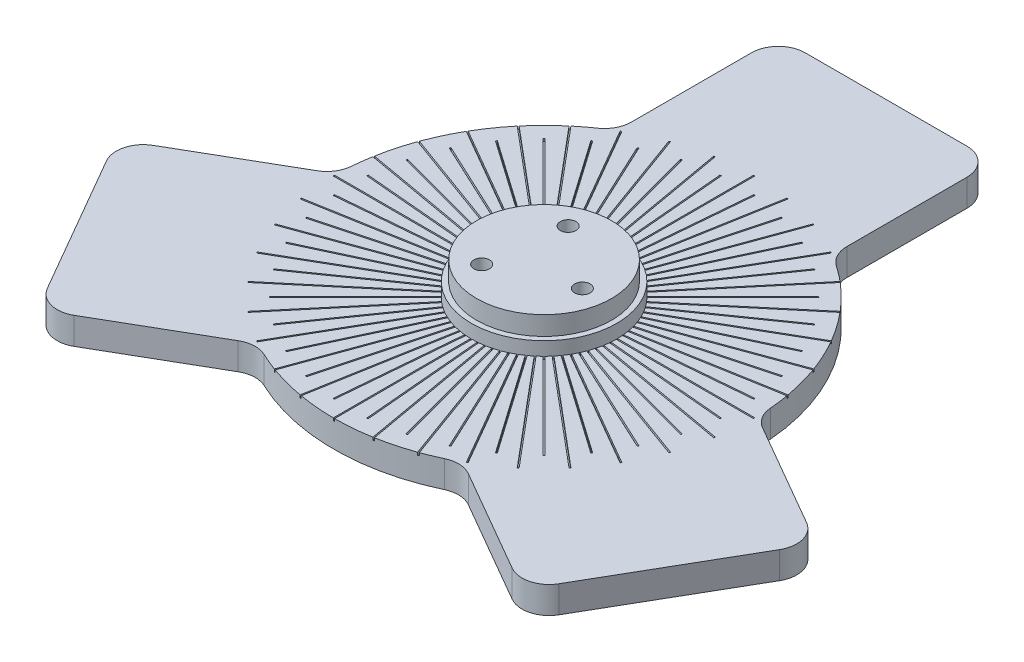
from build123d import *

# Parameters (mm, degrees)
BOSS_EXTRUDE1_DEPTH           = 10
SKETCH2_R                     = 27
BOSS_EXTRUDE2_DEPTH           = 5
SKETCH3_R                     = 25.05
BOSS_EXTRUDE3_DEPTH           = 7
CBORE_FOR_M5_SHCS1_AT_2_COUNT = 2
CBORE_FOR_M5_SHCS1_AT_2_PITCH = 28.596158833
CBORE_FOR_M5_SHCS1_AT_3_COUNT = 2
CBORE_FOR_M5_SHCS1_AT_3_PITCH = 28.596158833
FILLET1_R                     = 10
SKETCH7_W                     = 0.5
SKETCH7_H                     = 51
SKETCH7_W_2                   = 51
SKETCH7_H_2                   = 0.5
CUT_EXTRUDE2_DEPTH            = 1
CUT_EXTRUDE3_DEPTH            = 1


with BuildPart() as part:
    # Sketch1 → Boss-Extrude1 (new body)
    with BuildSketch(Plane(origin=(0, 0, 0), x_dir=(1, 0, 0), z_dir=(0, 1, 0))):
        with BuildLine():
            Line((-40, 126.962676171), (-40, 66.962676171))
            ThreePointArc((-40, 66.962676171), (-67.549981495, 39), (-77.99137867, 1.159678066))
            Line((-77.99137867, 1.159678066), (-129.952902897, -28.840321934))
            Line((-129.952902897, -28.840321934), (-89.952902897, -98.122354237))
            Line((-89.952902897, -98.122354237), (-37.99137867, -68.122354237))
            ThreePointArc((-37.99137867, -68.122354237), (0, -78), (37.99137867, -68.122354237))
            Line((37.99137867, -68.122354237), (89.952902897, -98.122354237))
            Line((89.952902897, -98.122354237), (129.952902897, -28.840321934))
            Line((129.952902897, -28.840321934), (77.99137867, 1.159678066))
            ThreePointArc((77.99137867, 1.159678066), (67.549981495, 39), (40, 66.962676171))
            Line((40, 66.962676171), (40, 126.962676171))
            Line((40, 126.962676171), (-40, 126.962676171))
        make_face()
    extrude(amount=BOSS_EXTRUDE1_DEPTH)

    # Sketch2 → Boss-Extrude2 (add)
    with BuildSketch(Plane(origin=(0, 10, 0), x_dir=(1, 0, 0), z_dir=(0, 1, 0))):
        Circle(SKETCH2_R)
    extrude(amount=BOSS_EXTRUDE2_DEPTH)

    # Sketch3 → Boss-Extrude3 (add)
    with BuildSketch(Plane(origin=(0, 15, 0), x_dir=(1, 0, 0), z_dir=(0, 1, 0))):
        Circle(SKETCH3_R)
    extrude(amount=BOSS_EXTRUDE3_DEPTH)

    # Sketch5 → CBORE for M5 SHCS1 (revolve, cut)
    with BuildSketch(Plane(origin=(16.368754661, 0, 2.154987434), x_dir=(0, 0, -1), z_dir=(1, 0, 0))):
        Polygon((0, 0), (0, 22), (2.9, 22), (2.9, 5), (5, 5), (5, 0.025), (5.025, 0), align=None)
    cbore_for_m5_shcs1 = revolve(axis=Axis((16.368754661, -6.35, 2.154987434), (0, 1, 0)), mode=Mode.SUBTRACT)

    # CBORE for M5 SHCS1 at 2: CBORE for M5 SHCS1 ×2
    with Locations(*[Vector(-0.7933533402912365, 0, -0.608761429008719) * (i * CBORE_FOR_M5_SHCS1_AT_2_PITCH) for i in range(1, CBORE_FOR_M5_SHCS1_AT_2_COUNT)]):
        add(cbore_for_m5_shcs1, mode=Mode.SUBTRACT)

    # CBORE for M5 SHCS1 at 3: CBORE for M5 SHCS1 ×2
    with Locations(*[Vector(-0.9238795325112866, 0, 0.38268343236509017) * (i * CBORE_FOR_M5_SHCS1_AT_3_PITCH) for i in range(1, CBORE_FOR_M5_SHCS1_AT_3_COUNT)]):
        add(cbore_for_m5_shcs1, mode=Mode.SUBTRACT)

    # Fillet1
    fillet1_edges = [part.edges().sort_by_distance(p)[0] for p in [
        (40, 5, -66.962676171),
        (-40, 5, -66.962676171),
        (40, 5, -126.962676171),
        (-40, 5, -126.962676171),
        (77.99137867, 5, -1.159678066),
        (129.952902897, 5, 28.840321934),
        (89.952902897, 5, 98.122354237),
        (37.99137867, 5, 68.122354237),
        (-37.99137867, 5, 68.122354237),
        (-89.952902897, 5, 98.122354237),
        (-129.952902897, 5, 28.840321934),
        (-77.99137867, 5, -1.159678066),
    ]]
    fillet(fillet1_edges, radius=FILLET1_R)

    # Sketch7 → Cut-Extrude2 (cut)
    with BuildSketch(Plane(origin=(0, 10, 0), x_dir=(1, 0, 0), z_dir=(0, 1, 0))):
        Polygon((13.29835592, 76.858416779), (4.442298859, 26.633221376), (4.934702735, 26.546397287), (13.790759796, 76.771592691), align=None)
        with Locations((0, 52.5)):
            Rectangle(SKETCH7_W, SKETCH7_H)
        Polygon((26.442648024, 73.381529457), (8.999620715, 25.457205797), (9.469467025, 25.286195725), (26.912494335, 73.210519385), align=None)
        Polygon((38.783493649, 67.674981495), (13.283493649, 23.507685902), (13.716506351, 23.257685902), (39.216506351, 67.424981495), align=None)
        Polygon((49.945922445, 59.912163466), (17.163754351, 20.843896867), (17.546776572, 20.522503062), (50.328944666, 59.590769661), align=None)
        Polygon((59.590769661, 50.328944666), (20.522503062, 17.546776572), (20.843896867, 17.163754351), (59.912163466, 49.945922445), align=None)
        Polygon((67.424981495, 39.216506351), (23.257685902, 13.716506351), (23.507685902, 13.283493649), (67.674981495, 38.783493649), align=None)
        Polygon((73.210519385, 26.912494335), (25.286195725, 9.469467025), (25.457205797, 8.999620715), (73.381529457, 26.442648024), align=None)
        Polygon((76.771592691, 13.790759796), (26.546397287, 4.934702735), (26.633221376, 4.442298859), (76.858416779, 13.29835592), align=None)
        with Locations((52.5, 0)):
            Rectangle(SKETCH7_W_2, SKETCH7_H_2)
        Polygon((76.858416779, -13.29835592), (26.633221376, -4.442298859), (26.546397287, -4.934702735), (76.771592691, -13.790759796), align=None)
        Polygon((73.381529457, -26.442648024), (25.457205797, -8.999620715), (25.286195725, -9.469467025), (73.210519385, -26.912494335), align=None)
        Polygon((67.674981495, -38.783493649), (23.507685902, -13.283493649), (23.257685902, -13.716506351), (67.424981495, -39.216506351), align=None)
        Polygon((59.912163466, -49.945922445), (20.843896867, -17.163754351), (20.522503062, -17.546776572), (59.590769661, -50.328944666), align=None)
        Polygon((50.328944666, -59.590769661), (17.546776572, -20.522503062), (17.163754351, -20.843896867), (49.945922445, -59.912163466), align=None)
        Polygon((39.216506351, -67.424981495), (13.716506351, -23.257685902), (13.283493649, -23.507685902), (38.783493649, -67.674981495), align=None)
        Polygon((26.912494335, -73.210519385), (9.469467025, -25.286195725), (8.999620715, -25.457205797), (26.442648024, -73.381529457), align=None)
        Polygon((13.790759796, -76.771592691), (4.934702735, -26.546397287), (4.442298859, -26.633221376), (13.29835592, -76.858416779), align=None)
        with Locations((0, -52.5)):
            Rectangle(SKETCH7_W, SKETCH7_H)
        Polygon((-13.29835592, -76.858416779), (-4.442298859, -26.633221376), (-4.934702735, -26.546397287), (-13.790759796, -76.771592691), align=None)
        Polygon((-26.442648024, -73.381529457), (-8.999620715, -25.457205797), (-9.469467025, -25.286195725), (-26.912494335, -73.210519385), align=None)
        Polygon((-38.783493649, -67.674981495), (-13.283493649, -23.507685902), (-13.716506351, -23.257685902), (-39.216506351, -67.424981495), align=None)
        Polygon((-49.945922445, -59.912163466), (-17.163754351, -20.843896867), (-17.546776572, -20.522503062), (-50.328944666, -59.590769661), align=None)
        Polygon((-59.590769661, -50.328944666), (-20.522503062, -17.546776572), (-20.843896867, -17.163754351), (-59.912163466, -49.945922445), align=None)
        Polygon((-67.424981495, -39.216506351), (-23.257685902, -13.716506351), (-23.507685902, -13.283493649), (-67.674981495, -38.783493649), align=None)
        Polygon((-73.210519385, -26.912494335), (-25.286195725, -9.469467025), (-25.457205797, -8.999620715), (-73.381529457, -26.442648024), align=None)
        Polygon((-76.771592691, -13.790759796), (-26.546397287, -4.934702735), (-26.633221376, -4.442298859), (-76.858416779, -13.29835592), align=None)
        with Locations((-52.5, 0)):
            Rectangle(SKETCH7_W_2, SKETCH7_H_2)
        Polygon((-76.858416779, 13.29835592), (-26.633221376, 4.442298859), (-26.546397287, 4.934702735), (-76.771592691, 13.790759796), align=None)
        Polygon((-73.381529457, 26.442648024), (-25.457205797, 8.999620715), (-25.286195725, 9.469467025), (-73.210519385, 26.912494335), align=None)
        Polygon((-67.674981495, 38.783493649), (-23.507685902, 13.283493649), (-23.257685902, 13.716506351), (-67.424981495, 39.216506351), align=None)
        Polygon((-59.912163466, 49.945922445), (-20.843896867, 17.163754351), (-20.522503062, 17.546776572), (-59.590769661, 50.328944666), align=None)
        Polygon((-50.328944666, 59.590769661), (-17.546776572, 20.522503062), (-17.163754351, 20.843896867), (-49.945922445, 59.912163466), align=None)
        Polygon((-39.216506351, 67.424981495), (-13.716506351, 23.257685902), (-13.283493649, 23.507685902), (-38.783493649, 67.674981495), align=None)
        Polygon((-26.912494335, 73.210519385), (-9.469467025, 25.286195725), (-8.999620715, 25.457205797), (-26.442648024, 73.381529457), align=None)
        Polygon((-13.790759796, 76.771592691), (-4.934702735, 26.546397287), (-4.442298859, 26.633221376), (-13.29835592, 76.858416779), align=None)
    extrude(amount=-CUT_EXTRUDE2_DEPTH, mode=Mode.SUBTRACT)

    # Sketch8 → Cut-Extrude3 (cut)
    with BuildSketch(Plane(origin=(0, 10, 0), x_dir=(1, 0, 0), z_dir=(0, 1, 0))):
        Polygon((2.111238956, 27), (6.033247379, 71.828761414), (6.535157298, 71.828761414), (2.613148875, 27), align=None)
        Polygon((7.261950068, 26.136040791), (6.767665289, 26.223196534), (18.414522319, 69.689858717), (18.908807098, 69.602702974), align=None)
        Polygon((11.690100584, 24.477951209), (11.218459537, 24.649614511), (30.236281316, 65.433464928), (30.707922363, 65.261801625), align=None)
        Polygon((15.763053309, 22.076111465), (15.328386569, 22.327066424), (41.139326205, 59.188908417), (41.573992945, 58.937953458), align=None)
        Polygon((19.357053636, 19.003500245), (18.972568332, 19.326121722), (50.792373485, 51.145926876), (51.176858789, 50.823305399), align=None)
        Polygon((22.362899683, 15.353477287), (22.040278206, 15.737962591), (58.902120199, 41.548902227), (59.224741676, 41.164416923), align=None)
        Polygon((24.689260339, 11.236946691), (24.43830538, 11.671613431), (65.222155797, 30.689435209), (65.473110756, 30.254768469), align=None)
        Polygon((26.265450314, 6.778987155), (26.093787011, 7.250628202), (69.560449194, 18.897485232), (69.732112497, 18.425844185), align=None)
        Polygon((27.043577871, 2.115051526), (26.956422129, 2.609336305), (71.785183543, 6.531344729), (71.872339286, 6.037059949), align=None)
        Polygon((27, -2.613148875), (27, -2.111238956), (71.828761414, -6.033247379), (71.828761414, -6.535157298), align=None)
        Polygon((26.136040791, -7.261950068), (26.223196534, -6.767665289), (69.689858717, -18.414522319), (69.602702974, -18.908807098), align=None)
        Polygon((24.477951209, -11.690100584), (24.649614511, -11.218459537), (65.433464928, -30.236281316), (65.261801625, -30.707922363), align=None)
        Polygon((22.076111465, -15.763053309), (22.327066424, -15.328386569), (59.188908417, -41.139326205), (58.937953458, -41.573992945), align=None)
        Polygon((19.003500245, -19.357053636), (19.326121722, -18.972568332), (51.145926876, -50.792373485), (50.823305399, -51.176858789), align=None)
        Polygon((15.353477287, -22.362899683), (15.737962591, -22.040278206), (41.548902227, -58.902120199), (41.164416923, -59.224741676), align=None)
        Polygon((11.236946691, -24.689260339), (11.671613431, -24.43830538), (30.689435209, -65.222155797), (30.254768469, -65.473110756), align=None)
        Polygon((6.778987155, -26.265450314), (7.250628202, -26.093787011), (18.897485232, -69.560449194), (18.425844185, -69.732112497), align=None)
        Polygon((2.115051526, -27.043577871), (2.609336305, -26.956422129), (6.531344729, -71.785183543), (6.037059949, -71.872339286), align=None)
        Polygon((-2.613148875, -27), (-2.111238956, -27), (-6.033247379, -71.828761414), (-6.535157298, -71.828761414), align=None)
        Polygon((-7.261950068, -26.136040791), (-6.767665289, -26.223196534), (-18.414522319, -69.689858717), (-18.908807098, -69.602702974), align=None)
        Polygon((-11.690100584, -24.477951209), (-11.218459537, -24.649614511), (-30.236281316, -65.433464928), (-30.707922363, -65.261801625), align=None)
        Polygon((-15.763053309, -22.076111465), (-15.328386569, -22.327066424), (-41.139326205, -59.188908417), (-41.573992945, -58.937953458), align=None)
        Polygon((-19.357053636, -19.003500245), (-18.972568332, -19.326121722), (-50.792373485, -51.145926876), (-51.176858789, -50.823305399), align=None)
        Polygon((-22.362899683, -15.353477287), (-22.040278206, -15.737962591), (-58.902120199, -41.548902227), (-59.224741676, -41.164416923), align=None)
        Polygon((-24.689260339, -11.236946691), (-24.43830538, -11.671613431), (-65.222155797, -30.689435209), (-65.473110756, -30.254768469), align=None)
        Polygon((-26.265450314, -6.778987155), (-26.093787011, -7.250628202), (-69.560449194, -18.897485232), (-69.732112497, -18.425844185), align=None)
        Polygon((-27.043577871, -2.115051526), (-26.956422129, -2.609336305), (-71.785183543, -6.531344729), (-71.872339286, -6.037059949), align=None)
        Polygon((-27, 2.613148875), (-27, 2.111238956), (-71.828761414, 6.033247379), (-71.828761414, 6.535157298), align=None)
        Polygon((-26.136040791, 7.261950068), (-26.223196534, 6.767665289), (-69.689858717, 18.414522319), (-69.602702974, 18.908807098), align=None)
        Polygon((-24.477951209, 11.690100584), (-24.649614511, 11.218459537), (-65.433464928, 30.236281316), (-65.261801625, 30.707922363), align=None)
        Polygon((-22.076111465, 15.763053309), (-22.327066424, 15.328386569), (-59.188908417, 41.139326205), (-58.937953458, 41.573992945), align=None)
        Polygon((-19.003500245, 19.357053636), (-19.326121722, 18.972568332), (-51.145926876, 50.792373485), (-50.823305399, 51.176858789), align=None)
        Polygon((-15.353477287, 22.362899683), (-15.737962591, 22.040278206), (-41.548902227, 58.902120199), (-41.164416923, 59.224741676), align=None)
        Polygon((-11.236946691, 24.689260339), (-11.671613431, 24.43830538), (-30.689435209, 65.222155797), (-30.254768469, 65.473110756), align=None)
        Polygon((-6.778987155, 26.265450314), (-7.250628202, 26.093787011), (-18.897485232, 69.560449194), (-18.425844185, 69.732112497), align=None)
        Polygon((-2.115051526, 27.043577871), (-2.609336305, 26.956422129), (-6.531344729, 71.785183543), (-6.037059949, 71.872339286), align=None)
    extrude(amount=-CUT_EXTRUDE3_DEPTH, mode=Mode.SUBTRACT)


solid = part.part
